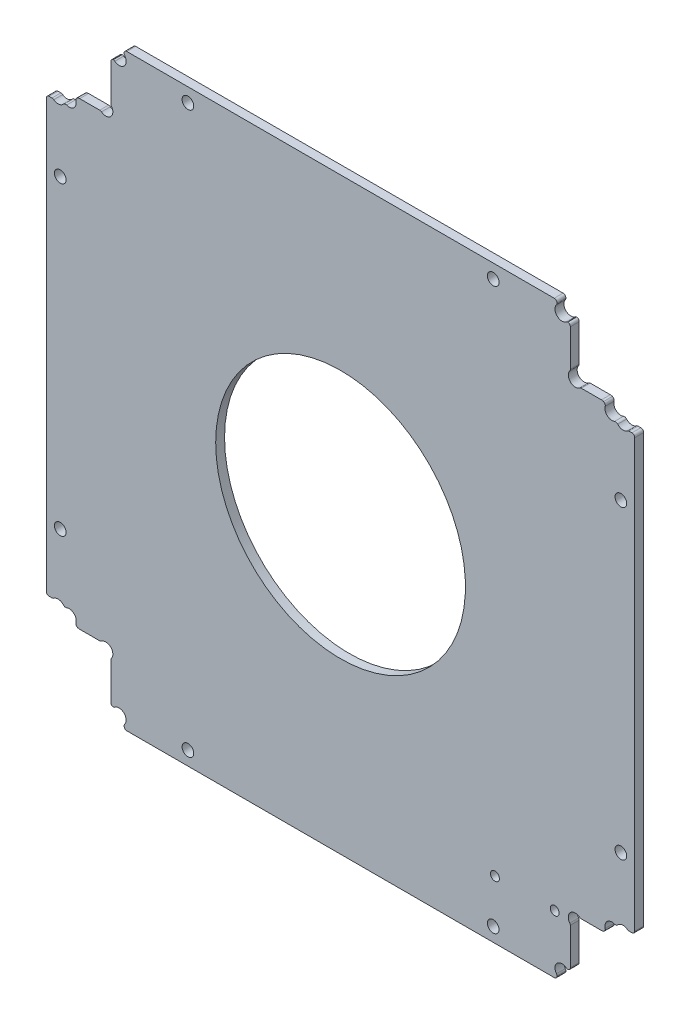
from build123d import *

# Parameters (mm, degrees)
SKETCH1_W                           = 106
SKETCH1_H                           = 106
MAINOUTLINE_DEPTH                   = 1.6
SKETCH4_W                           = 11.6
SKETCH4_H                           = 11.6
RAILCUTOUTS_DEPTH                   = 75.970394157
SKETCH13_W                          = 2.4
SKETCH13_H                          = 2.5
FILLETCUTOUTS_DEPTH                 = 75.970394157
DOGBONE_DEPTH                       = 75.970394157
SKETCH_PATTERN1_DEPTH               = 1.6
MIRROR2_COPY_1_SKETCH_W             = 11.6
MIRROR2_COPY_1_SKETCH_H             = 11.6
MIRROR2_COPY_1_DEPTH                = 75.970394157
MIRROR2_COPY_2_SKETCH_W             = 2.4
MIRROR2_COPY_2_SKETCH_H             = 2.5
MIRROR2_COPY_2_DEPTH                = 75.970394157
MIRROR2_COPY_3_DEPTH                = 75.970394157
MIRROR2_COPY_4_DEPTH                = 1.6
FILLET1_R                           = 0.5
M2_CLEARANCE_HOLE1_D                = 2.1
INTERBOARDCONNECTORHOLES_DEPTH      = 75.970394157
INTERBOARDCONNECTORHOLES_DEPTH_BACK = 75.970394157
SKETCH12_R                          = 0.8
CUT_EXTRUDE2_DEPTH                  = 75.970394157
CUT_EXTRUDE2_DEPTH_BACK             = 75.970394157
SKETCH11_R                          = 22.5
SKETCH15_W                          = 90
SKETCH15_H                          = 6.2
SKETCH15_W_2                        = 5.2
SKETCH15_H_2                        = 90
CUT_EXTRUDE5_DEPTH                  = 0.001


# Read off the part's stored shape, not the designer's step: Sketch-Pattern1
with BuildPart() as part:
    # Sketch1 → mainOutline (new body)
    with BuildSketch(Plane.XY):
        Rectangle(SKETCH1_W, SKETCH1_H)
    extrude(amount=MAINOUTLINE_DEPTH)

    # Sketch4 → railCutouts (cut, through all)
    with BuildSketch(Plane(origin=(0, 0, 0), x_dir=(-1, 0, 0), z_dir=(0, 0, -1))):
        with Locations((47.2, 47.2)):
            Rectangle(SKETCH4_W, SKETCH4_H)
    railcutouts = extrude(amount=-RAILCUTOUTS_DEPTH, mode=Mode.SUBTRACT)

    # Sketch13 → filletCutouts (cut, symmetric)
    with BuildSketch(Plane(origin=(0, 0, 0), x_dir=(-1, 0, 0), z_dir=(0, 0, -1))):
        with BuildLine():
            Line((48, 39.5), (48, 40.4))
            ThreePointArc((48, 40.4), (47.707106781, 41.107106781), (47, 41.4))
            Line((47, 41.4), (53, 41.4))
            Line((53, 41.4), (53, 39))
            Line((53, 39), (50, 39))
            Line((50, 39), (50, 39.5))
            Line((50, 39.5), (48, 39.5))
        make_face()
        with Locations((40.2, 51.75)):
            Rectangle(SKETCH13_W, SKETCH13_H)
    filletcutouts = extrude(amount=FILLETCUTOUTS_DEPTH, both=True, mode=Mode.SUBTRACT)

    # Sketch5 → dogbone (cut, through all)
    with BuildSketch(Plane(origin=(0, 0, 0), x_dir=(-1, 0, 0), z_dir=(0, 0, -1))):
        with BuildLine():
            Line((41.4, 43.196051224), (44.582309033, 46.378360258))
            ThreePointArc((44.582309033, 46.378360258), (46.378360258, 46.378360258), (46.378360258, 44.582309033))
            Line((46.378360258, 44.582309033), (43.196051224, 41.4))
            ThreePointArc((43.196051224, 41.4), (41.4, 41.4), (41.4, 43.196051224))
        make_face()
    dogbone = extrude(amount=-DOGBONE_DEPTH, mode=Mode.SUBTRACT)

    # Sketch-Pattern1 outline → Sketch-Pattern1 (cut)
    with BuildSketch(Plane.XY):
        with BuildLine():
            ThreePointArc((-51.796051224, 39), (-50.898025612, 38.628025612), (-50, 39))
            Line((-50, 39), (-51.796051224, 39))
        make_face()
        with BuildLine():
            Line((-48, 40.4), (-48, 39.5))
            ThreePointArc((-48, 39.5), (-47.640251053, 40.222232671), (-47.788196764, 41.015423319))
            ThreePointArc((-47.788196764, 41.015423319), (-47.945567756, 40.725425288), (-48, 40.4))
        make_face()
        with BuildLine():
            ThreePointArc((-50, 39), (-49.837206518, 39.199768603), (-49.718090983, 39.428287097))
            ThreePointArc((-49.718090983, 39.428287097), (-48.845062088, 39.129130476), (-48, 39.5))
            Line((-48, 39.5), (-50, 39.5))
            Line((-50, 39.5), (-50, 39))
        make_face()
        with BuildLine():
            ThreePointArc((-40.796051224, 50.5), (-39.898025612, 50.128025612), (-39, 50.5))
            Line((-39, 50.5), (-40.796051224, 50.5))
        make_face()
        with BuildLine():
            ThreePointArc((-39, 50.5), (-38.628025612, 51.398025612), (-39, 52.296051224))
            Line((-39, 52.296051224), (-39, 50.5))
        make_face()
    sketch_pattern1 = extrude(amount=SKETCH_PATTERN1_DEPTH, mode=Mode.SUBTRACT)

    # Mirror1: railCutouts, filletCutouts, dogbone, Sketch-Pattern1 across plane
    add(railcutouts.mirror(Plane(origin=(0, 0, 0), x_dir=(0, 0, 1), z_dir=(1, 0, 0))), mode=Mode.SUBTRACT)
    add(filletcutouts.mirror(Plane(origin=(0, 0, 0), x_dir=(0, 0, 1), z_dir=(1, 0, 0))), mode=Mode.SUBTRACT)
    add(dogbone.mirror(Plane(origin=(0, 0, 0), x_dir=(0, 0, 1), z_dir=(1, 0, 0))), mode=Mode.SUBTRACT)
    add(sketch_pattern1.mirror(Plane(origin=(0, 0, 0), x_dir=(0, 0, 1), z_dir=(1, 0, 0))), mode=Mode.SUBTRACT)

    # Mirror2: railCutouts, filletCutouts, dogbone, Sketch-Pattern1 across plane
    add(railcutouts.mirror(Plane.ZX), mode=Mode.SUBTRACT)
    add(filletcutouts.mirror(Plane.ZX), mode=Mode.SUBTRACT)
    add(dogbone.mirror(Plane.ZX), mode=Mode.SUBTRACT)
    add(sketch_pattern1.mirror(Plane.ZX), mode=Mode.SUBTRACT)

    # Mirror2 copy 1 sketch → Mirror2 copy 1 (cut, through all)
    with BuildSketch(Plane(origin=(0, 0, 0), x_dir=(1, 0, 0), z_dir=(0, 0, -1))):
        with Locations((47.2, 47.2)):
            Rectangle(MIRROR2_COPY_1_SKETCH_W, MIRROR2_COPY_1_SKETCH_H)
    extrude(amount=-MIRROR2_COPY_1_DEPTH, mode=Mode.SUBTRACT)

    # Mirror2 copy 2 sketch → Mirror2 copy 2 (cut, symmetric)
    with BuildSketch(Plane(origin=(0, 0, 0), x_dir=(1, 0, 0), z_dir=(0, 0, -1))):
        with BuildLine():
            Line((48, 39.5), (48, 40.4))
            ThreePointArc((48, 40.4), (47.707106781, 41.107106781), (47, 41.4))
            Line((47, 41.4), (53, 41.4))
            Line((53, 41.4), (53, 39))
            Line((53, 39), (50, 39))
            Line((50, 39), (50, 39.5))
            Line((50, 39.5), (48, 39.5))
        make_face()
        with Locations((40.2, 51.75)):
            Rectangle(MIRROR2_COPY_2_SKETCH_W, MIRROR2_COPY_2_SKETCH_H)
    extrude(amount=MIRROR2_COPY_2_DEPTH, both=True, mode=Mode.SUBTRACT)

    # Mirror2 copy 3 sketch → Mirror2 copy 3 (cut, through all)
    with BuildSketch(Plane(origin=(0, 0, 0), x_dir=(1, 0, 0), z_dir=(0, 0, -1))):
        with BuildLine():
            Line((41.4, 43.196051224), (44.582309033, 46.378360258))
            ThreePointArc((44.582309033, 46.378360258), (46.378360258, 46.378360258), (46.378360258, 44.582309033))
            Line((46.378360258, 44.582309033), (43.196051224, 41.4))
            ThreePointArc((43.196051224, 41.4), (41.4, 41.4), (41.4, 43.196051224))
        make_face()
    extrude(amount=-MIRROR2_COPY_3_DEPTH, mode=Mode.SUBTRACT)

    # Mirror2 copy 4 sketch → Mirror2 copy 4 (cut)
    with BuildSketch(Plane(origin=(0, 0, 0), x_dir=(-1, 0, 0), z_dir=(0, 0, 1))):
        with BuildLine():
            ThreePointArc((-51.796051224, 39), (-50.898025612, 38.628025612), (-50, 39))
            Line((-50, 39), (-51.796051224, 39))
        make_face()
        with BuildLine():
            Line((-48, 40.4), (-48, 39.5))
            ThreePointArc((-48, 39.5), (-47.640251053, 40.222232671), (-47.788196764, 41.015423319))
            ThreePointArc((-47.788196764, 41.015423319), (-47.945567756, 40.725425288), (-48, 40.4))
        make_face()
        with BuildLine():
            ThreePointArc((-50, 39), (-49.837206518, 39.199768603), (-49.718090983, 39.428287097))
            ThreePointArc((-49.718090983, 39.428287097), (-48.845062088, 39.129130476), (-48, 39.5))
            Line((-48, 39.5), (-50, 39.5))
            Line((-50, 39.5), (-50, 39))
        make_face()
        with BuildLine():
            ThreePointArc((-40.796051224, 50.5), (-39.898025612, 50.128025612), (-39, 50.5))
            Line((-39, 50.5), (-40.796051224, 50.5))
        make_face()
        with BuildLine():
            ThreePointArc((-39, 50.5), (-38.628025612, 51.398025612), (-39, 52.296051224))
            Line((-39, 52.296051224), (-39, 50.5))
        make_face()
    extrude(amount=MIRROR2_COPY_4_DEPTH, mode=Mode.SUBTRACT)

    # Fillet1
    # the kernel refuses this fillet: 0.5 mm, written as the material it takes off along each edge
    with BuildSketch(Plane(origin=(-40.796051224, 50.5, -0.468817401), x_dir=(-1, 0, 0), z_dir=(0, 0, 1)), Plane(origin=(41.4, 43.196051224, -0.468817401), x_dir=(0, 1, 0), z_dir=(0, 0, 1)), Plane(origin=(39, 52.296051224, -0.468817401), x_dir=(0, 1, 0), z_dir=(0, 0, 1)), Plane(origin=(43.196051224, -41.4, -0.468817401), x_dir=(1, 0, 0), z_dir=(0, 0, 1)), Plane(origin=(40.796051224, -50.5, -0.468817401), x_dir=(1, 0, 0), z_dir=(0, 0, 1)), Plane(origin=(51.796051224, -39, -0.468817401), x_dir=(1, 0, 0), z_dir=(0, 0, 1)), Plane(origin=(-41.4, -43.196051224, -0.468817401), x_dir=(0, -1, 0), z_dir=(0, 0, 1)), Plane(origin=(-39, -52.296051224, -0.468817401), x_dir=(0, -1, 0), z_dir=(0, 0, 1)), Plane(origin=(-43.196051224, 41.4, -0.468817401), x_dir=(-1, 0, 0), z_dir=(0, 0, 1))) as fillet1_piece_1:
        with BuildLine():
            CenterArc((0.187526961, 0.5), FILLET1_R, 232.171026852, 37.828973148)
            ThreePointArc((-0.119126309, 0.105077511), (-0.057918706, 0.054403066), (0, 0))
            Line((0, 0), (0.187526961, 0))
        make_face()
    extrude(amount=2.537634803, mode=Mode.SUBTRACT)
    with BuildSketch(Plane(origin=(-39, 52.296051224, -0.468817401), x_dir=(0, 1, 0), z_dir=(0, 0, 1))) as fillet1_piece_2:
        with BuildLine():
            CenterArc((0.187526961, -0.5), FILLET1_R, 90, 37.828973148)
            ThreePointArc((-0.119126309, -0.105077511), (-0.057918706, -0.054403066), (0, 0))
            Line((0, 0), (0.187526961, 0))
        make_face()
    extrude(amount=2.537634803, mode=Mode.SUBTRACT)
    with BuildSketch(Plane(origin=(-49.718090983, 39.428287097, -1.02833381), x_dir=(-0.5154483763145984, -0.8569206330545696, 0), z_dir=(0, 0, 1)), Plane(origin=(49.718090983, 39.428287097, -1.02833381), x_dir=(-0.8580641587400395, -0.5135425001747647, 0), z_dir=(0, 0, 1)), Plane(origin=(49.718090983, -39.428287097, -1.02833381), x_dir=(0.5154483763145984, 0.8569206330545696, 0), z_dir=(0, 0, 1)), Plane(origin=(-49.718090983, -39.428287097, -1.02833381), x_dir=(0.8580641587400395, 0.5135425001747647, 0), z_dir=(0, 0, 1))) as fillet1_piece_3:
        with BuildLine():
            CenterArc((0.49230469, 0.493400112), FILLET1_R, 189.447000606, 71.233345199)
            ThreePointArc((-0.000914235, 0.411332508), (0.016306557, 0.205703513), (0, 0))
            ThreePointArc((0, 0), (0.205666762, 0.016763716), (0.411333524, 0))
        make_face()
    extrude(amount=3.65666762, mode=Mode.SUBTRACT)
    with BuildSketch(Plane(origin=(-51.796051224, 39, -0.468817401), x_dir=(0.74994384051794, -0.6615015011843909, 0), z_dir=(0, 0, 1))) as fillet1_piece_4:
        with BuildLine():
            CenterArc((0.190116062, -0.499021286), FILLET1_R, 93.585513434, 37.828973148)
            Line((-0.140634689, -0.124049366), (0, 0))
            ThreePointArc((0, 0), (0.079423486, -0.002485933), (0.158846972, 0))
        make_face()
    extrude(amount=2.537634803, mode=Mode.SUBTRACT)
    with BuildSketch(Plane(origin=(53, 39, -1.25), x_dir=(-1, 0, 0), z_dir=(0, 0, 1)), Plane(origin=(41.4, 50.5, -1.25), x_dir=(-1, 0, 0), z_dir=(0, 0, 1)), Plane(origin=(53, -39, -1.25), x_dir=(0, 1, 0), z_dir=(0, 0, 1)), Plane(origin=(41.4, -50.5, -1.25), x_dir=(0, 1, 0), z_dir=(0, 0, 1)), Plane(origin=(-53, 39, -1.25), x_dir=(0, -1, 0), z_dir=(0, 0, 1)), Plane(origin=(-53, -39, -1.25), x_dir=(1, 0, 0), z_dir=(0, 0, 1)), Plane(origin=(-41.4, -50.5, -1.25), x_dir=(1, 0, 0), z_dir=(0, 0, 1)), Plane(origin=(-41.4, 50.5, -1.25), x_dir=(0, -1, 0), z_dir=(0, 0, 1)), Plane(origin=(-39, 53, 2.85), x_dir=(1, 0, 0), z_dir=(0, 0, -1))) as fillet1_piece_5:
        with BuildLine():
            CenterArc((FILLET1_R, FILLET1_R), FILLET1_R, 180, 90)
            Line((0, FILLET1_R), (0, 0))
            Line((0, 0), (FILLET1_R, 0))
        make_face()
    extrude(amount=4.1, mode=Mode.SUBTRACT)
    with BuildSketch(Plane(origin=(39, 53, 2.85), x_dir=(-1, 0, 0), z_dir=(0, 0, -1)), Plane(origin=(39, -53, 2.85), x_dir=(0, 1, 0), z_dir=(0, 0, -1)), Plane(origin=(-39, -53, 2.85), x_dir=(1, 0, 0), z_dir=(0, 0, -1))) as fillet1_piece_6:
        with BuildLine():
            CenterArc((FILLET1_R, -FILLET1_R), FILLET1_R, 90, 90)
            Line((0, -FILLET1_R), (0, 0))
            Line((0, 0), (FILLET1_R, 0))
        make_face()
    extrude(amount=4.1, mode=Mode.SUBTRACT)
    with BuildSketch(Plane(origin=(43.196051224, 41.4, -0.468817401), x_dir=(-0.7499438406786088, -0.6615015010022407, 0), z_dir=(0, 0, 1)), Plane(origin=(40.796051224, 50.5, -0.468817401), x_dir=(-0.7499438405179647, -0.6615015011843627, 0), z_dir=(0, 0, 1)), Plane(origin=(51.796051224, 39, -0.468817401), x_dir=(-0.74994384051794, -0.6615015011843909, 0), z_dir=(0, 0, 1)), Plane(origin=(41.4, -43.196051224, -0.468817401), x_dir=(-0.6615015010022215, 0.7499438406786257, 0), z_dir=(0, 0, 1)), Plane(origin=(39, -52.296051224, -0.468817401), x_dir=(-0.6615015011843849, 0.7499438405179452, 0), z_dir=(0, 0, 1)), Plane(origin=(-43.196051224, -41.4, -0.468817401), x_dir=(0.7499438406786088, 0.6615015010022407, 0), z_dir=(0, 0, 1)), Plane(origin=(-40.796051224, -50.5, -0.468817401), x_dir=(0.7499438405179647, 0.6615015011843627, 0), z_dir=(0, 0, 1)), Plane(origin=(-51.796051224, -39, -0.468817401), x_dir=(0.74994384051794, 0.6615015011843909, 0), z_dir=(0, 0, 1)), Plane(origin=(-41.4, 43.196051224, -0.468817401), x_dir=(0.6615015010022215, -0.7499438406786257, 0), z_dir=(0, 0, 1))) as fillet1_piece_7:
        with BuildLine():
            CenterArc((0.190116062, 0.499021286), FILLET1_R, 228.585513432, 37.828973137)
            Line((-0.140634689, 0.124049366), (0, 0))
            ThreePointArc((0, 0), (0.079423486, 0.002485933), (0.158846972, 0))
        make_face()
    extrude(amount=2.537634803, mode=Mode.SUBTRACT)
    with BuildSketch(Plane(origin=(47.788196764, 41.015423319, -1.280506532), x_dir=(-0.796757139689439, 0.6042996445091655, 0), z_dir=(0, 0, 1)), Plane(origin=(-47.788196764, -41.015423319, -1.280506532), x_dir=(0.796757139689439, -0.6042996445091655, 0), z_dir=(0, 0, 1))) as fillet1_piece_8:
        with BuildLine():
            CenterArc((0.384151959, 0.483324974), FILLET1_R, 201.96594505, 82.872907469)
            ThreePointArc((-0.079551214, 0.296297256), (-0.030795766, 0.150559576), (0, 0))
            ThreePointArc((0, 0), (0.256101306, -0.033350053), (0.512202613, 0))
        make_face()
    extrude(amount=4.161013063, mode=Mode.SUBTRACT)
    with BuildSketch(Plane(origin=(47.788196764, -41.015423319, -1.280506532), x_dir=(-0.3770302508373224, 0.9262009446948031, 0), z_dir=(0, 0, 1)), Plane(origin=(-47.788196764, 41.015423319, -1.280506532), x_dir=(0.3770302508373224, -0.9262009446948031, 0), z_dir=(0, 0, 1))) as fillet1_piece_9:
        with BuildLine():
            CenterArc((0.367182425, 0.496339425), FILLET1_R, 180.189758693, 82.872907469)
            ThreePointArc((-0.132814833, 0.494683471), (-0.098616779, 0.238694022), (0, 0))
            ThreePointArc((0, 0), (0.153395289, 0.00929786), (0.306790579, 0))
        make_face()
    extrude(amount=4.161013063, mode=Mode.SUBTRACT)

    # M2 Clearance Hole1 (through all)
    with Locations(Plane(origin=(0, 0, 0), x_dir=(-1, 0, 0), z_dir=(0, 0, -1))):
        with Locations((50.5, -27.5), (27.5, -50.5), (-50.5, -27.5), (-27.5, -50.5), (-27.5, 50.5), (-50.5, 27.5), (27.5, 50.5), (50.5, 27.5)):
            Hole(M2_CLEARANCE_HOLE1_D / 2)

    # Sketch12 → interboardConnectorHoles (cut, two sides: drawn at the far end of the back side and taken through both)
    with BuildSketch(Plane.XY.offset(1.6).offset(-INTERBOARDCONNECTORHOLES_DEPTH_BACK)):
        with Locations((27.815, -42.5)):
            Circle(SKETCH12_R)
        with Locations((38.585, -42.5)):
            Circle(SKETCH12_R)
    extrude(amount=INTERBOARDCONNECTORHOLES_DEPTH + INTERBOARDCONNECTORHOLES_DEPTH_BACK, mode=Mode.SUBTRACT)

    # Sketch11 → Cut-Extrude2 (cut, two sides: drawn at the far end of the back side and taken through both)
    with BuildSketch(Plane(origin=(0, 0, 0), x_dir=(-1, 0, 0), z_dir=(0, 0, -1)).offset(-CUT_EXTRUDE2_DEPTH_BACK)):
        Circle(SKETCH11_R)
    extrude(amount=CUT_EXTRUDE2_DEPTH + CUT_EXTRUDE2_DEPTH_BACK, mode=Mode.SUBTRACT)

    # Sketch15 → Cut-Extrude5 (cut)
    with BuildSketch(Plane(origin=(0, 0, 0), x_dir=(-1, 0, 0), z_dir=(0, 0, -1))):
        with Locations((0, 49.9)):
            Rectangle(SKETCH15_W, SKETCH15_H)
        with Locations((0, -49.9)):
            Rectangle(SKETCH15_W, SKETCH15_H)
        with Locations((-50.4, 0)):
            Rectangle(SKETCH15_W_2, SKETCH15_H_2)
        with Locations((50.4, 0)):
            Rectangle(SKETCH15_W_2, SKETCH15_H_2)
    extrude(amount=-CUT_EXTRUDE5_DEPTH, mode=Mode.SUBTRACT)


solid = part.part
